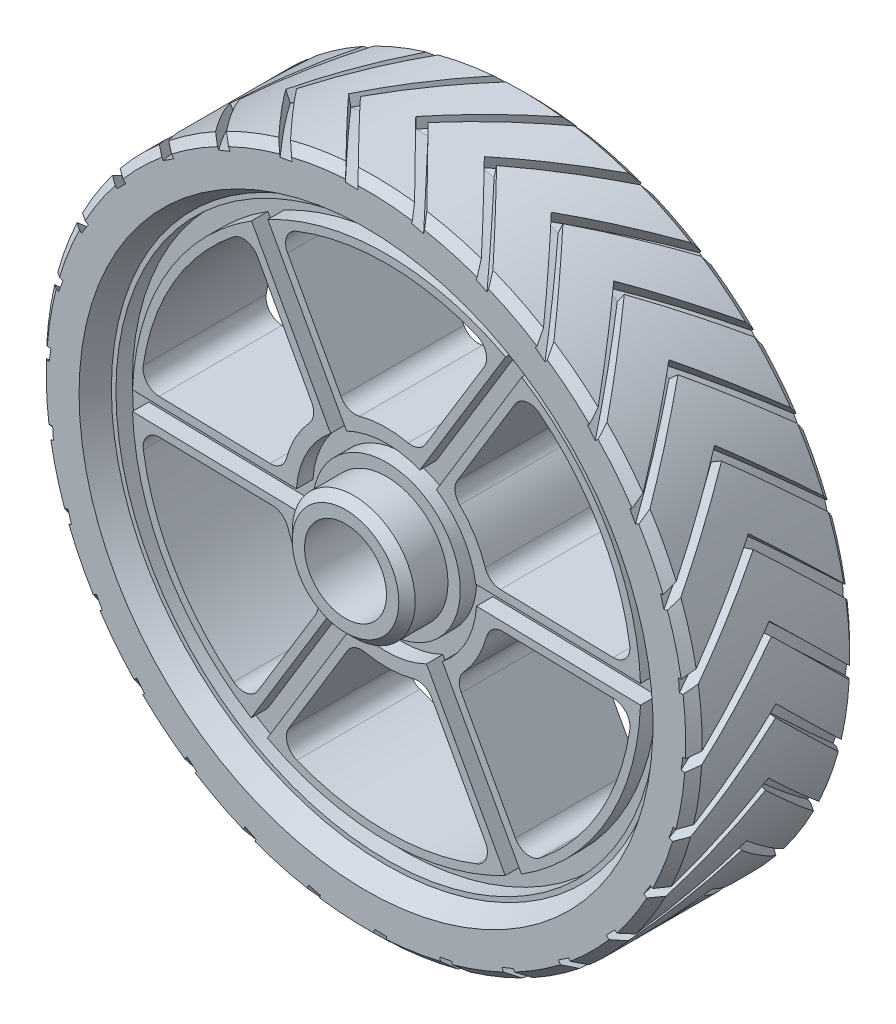
from build123d import *

# Parameters (mm, degrees)
SKETCH1_R               = 40
BOSS_EXTRUDE1_DEPTH     = 10
SKETCH2_R               = 35
CUT_EXTRUDE1_DEPTH      = 2.5
CUT_EXTRUDE1_DRAFT      = -30
MIRROR1_COPY_1_SKETCH_R = 35
MIRROR1_COPY_1_DEPTH    = 2.5
MIRROR1_COPY_1_DRAFT    = -30
CUT_EXTRUDE2_REACH      = 61.214
CIRPATTERN1_COUNT       = 6
SKETCH4_R               = 7.5
SKETCH4_R_2             = 5
BOSS_EXTRUDE2_DEPTH     = 5
CUT_EXTRUDE3_REACH      = 62
SKETCH5_R               = 5
SKETCH6_R               = 33
SKETCH6_R_2             = 9
CUT_EXTRUDE4_DEPTH      = 2
CHAMFER1_SIZE           = 1
CHAMFER2_SIZE           = 1
CUT_SWEEP1_PITCH        = 255
CUT_SWEEP1_HEIGHT       = 13
CUT_SWEEP1_RADIUS       = 40
CUT_SWEEP1_START_ANGLE  = 123
SKETCH8_W               = 1.5
SKETCH8_H               = 2.8
CUT_SWEEP2_PITCH        = 255
CUT_SWEEP2_HEIGHT       = 13
CUT_SWEEP2_RADIUS       = 40
CUT_SWEEP2_START_ANGLE  = 57
SKETCH8_2_W             = 1.5
SKETCH8_2_H             = 2.8
CIRPATTERN2_COUNT       = 30


with BuildPart() as part:
    # Sketch1 → Boss-Extrude1 (new, symmetric)
    with BuildSketch(Plane.XY):
        Circle(SKETCH1_R)
    extrude(amount=BOSS_EXTRUDE1_DEPTH, both=True)


with BuildPart() as cut_extrude1_tool:
    # Sketch2 → Cut-Extrude1 (with draft: the straight prism first)
    with BuildSketch(Plane(origin=(0, 0, -10), x_dir=(-1, 0, 0), z_dir=(0, 0, -1))):
        Circle(SKETCH2_R)
    extrude(amount=-CUT_EXTRUDE1_DEPTH)
    # Cut-Extrude1: the draft: its side faces are tilted about the plane it starts from
    cut_extrude1_sides = [cut_extrude1_tool.faces().sort_by_distance(p)[0] for p in [
        (35, 0, -8.75),
    ]]
    draft(cut_extrude1_sides, Plane(origin=(0, 0, -10), x_dir=(-1, 0, 0), z_dir=(0, 0, -1)), CUT_EXTRUDE1_DRAFT)


with BuildPart() as part_1:
    add(part.part)

    # Cut-Extrude1: cut by cut_extrude1_tool
    add(cut_extrude1_tool.part, mode=Mode.SUBTRACT)


with BuildPart() as mirror1_copy_1_tool:
    # Mirror1 copy 1 sketch → Mirror1 copy 1 (with draft: the straight prism first)
    with BuildSketch(Plane(origin=(0, 0, 10), x_dir=(-1, 0, 0), z_dir=(0, 0, 1))):
        Circle(MIRROR1_COPY_1_SKETCH_R)
    extrude(amount=-MIRROR1_COPY_1_DEPTH)
    # Mirror1 copy 1: the draft: its side faces are tilted about the plane it starts from
    mirror1_copy_1_sides = [mirror1_copy_1_tool.faces().sort_by_distance(p)[0] for p in [
        (35, 0, 8.75),
    ]]
    draft(mirror1_copy_1_sides, Plane(origin=(0, 0, 10), x_dir=(-1, 0, 0), z_dir=(0, 0, 1)), MIRROR1_COPY_1_DRAFT)


with BuildPart() as part_2:
    add(part_1.part)

    # Mirror1 copy 1: cut by mirror1_copy_1_tool
    add(mirror1_copy_1_tool.part, mode=Mode.SUBTRACT)

    # Sketch3 → Cut-Extrude2 (cut, up to next)
    with BuildSketch(Plane(origin=(0, 0, -7.5), x_dir=(-1, 0, 0), z_dir=(0, 0, -1)), mode=Mode.PRIVATE) as cut_extrude2_sk1:
        with BuildLine():
            Line((-4.767989648, 13.290749818), (-11.916023656, 25.033096023))
            ThreePointArc((-11.916023656, 25.033096023), (-12.102700892, 26.712435582), (-10.936778654, 27.935405361))
            ThreePointArc((-10.936778654, 27.935405361), (0.056157906, 29.999947438), (11.041288081, 27.894263882))
            ThreePointArc((11.041288081, 27.894263882), (12.186160929, 26.71434791), (12.060006234, 25.075134521))
            Line((12.060006234, 25.075134521), (5.561856046, 13.190986266))
            ThreePointArc((5.561856046, 13.190986266), (4.592885778, 12.311350051), (3.28744836, 12.219174127))
            ThreePointArc((3.28744836, 12.219174127), (0.331953442, 12.64932172), (-2.642034479, 12.374780276))
            ThreePointArc((-2.642034479, 12.374780276), (-3.851000273, 12.493928026), (-4.767989648, 13.290749818))
        make_face()
    cut_extrude2_tool1 = extrude(cut_extrude2_sk1.sketch, amount=-CUT_EXTRUDE2_REACH, mode=Mode.PRIVATE) & part_2.part
    cut_extrude2 = cut_extrude2_tool1.solids().sort_by_distance((-0.168446, 22.083331, -7.5))[0]
    add(cut_extrude2, mode=Mode.SUBTRACT)

    # CirPattern1: Cut-Extrude2 ×6 about axis
    cirpattern1_axis = Axis((0, 0, 0), (0, 0, 1))
    for i in range(1, CIRPATTERN1_COUNT):
        add(cut_extrude2.rotate(cirpattern1_axis, i * 360 / CIRPATTERN1_COUNT), mode=Mode.SUBTRACT)

    # Sketch4 → Boss-Extrude2 (add)
    with BuildSketch(Plane(origin=(0, 0, -7.5), x_dir=(-1, 0, 0), z_dir=(0, 0, -1))):
        Circle(SKETCH4_R)
        Circle(SKETCH4_R_2, mode=Mode.SUBTRACT)
    boss_extrude2 = extrude(amount=BOSS_EXTRUDE2_DEPTH)

    # Mirror2: Boss-Extrude2 across plane
    add(boss_extrude2.mirror(Plane.XY))

    # Sketch5 → Cut-Extrude3 (cut, up to next)
    with BuildSketch(Plane(origin=(0, 0, -7.5), x_dir=(-1, 0, 0), z_dir=(0, 0, -1)), mode=Mode.PRIVATE) as cut_extrude3_sk1:
        Circle(SKETCH5_R)
    cut_extrude3_tool1 = extrude(cut_extrude3_sk1.sketch, amount=-CUT_EXTRUDE3_REACH, mode=Mode.PRIVATE) & part_2.part
    add(cut_extrude3_tool1.solids().sort_by_distance((0, 0, -7.5))[0], mode=Mode.SUBTRACT)

    # Sketch6 → Cut-Extrude4 (cut)
    with BuildSketch(Plane(origin=(0, 0, -7.5), x_dir=(-1, 0, 0), z_dir=(0, 0, -1))):
        Circle(SKETCH6_R)
        Circle(SKETCH6_R_2, mode=Mode.SUBTRACT)
        with BuildLine():
            Line((-4.069208595, 10.219664447), (-14.520758821, 27.388821867))
            ThreePointArc((-14.520758821, 27.388821867), (-0.024534371, 30.999990291), (14.477387901, 27.411771916))
            Line((14.477387901, 27.411771916), (4.87943883, 9.858553479))
            ThreePointArc((4.87943883, 9.858553479), (0.44352964, 10.991054611), (-4.069208595, 10.219664447))
        make_face(mode=Mode.SUBTRACT)
        with BuildLine():
            Line((-16.500596892, 26.24367166), (-6.098038342, 9.154994723))
            ThreePointArc((-6.098038342, 9.154994723), (-9.296767688, 5.879635241), (-10.885093327, 1.585794207))
            Line((-10.885093327, 1.585794207), (-30.979794927, 1.119064912))
            ThreePointArc((-30.979794927, 1.119064912), (-26.859046295, 15.478747757), (-16.500596892, 26.24367166))
        make_face(mode=Mode.SUBTRACT)
        with BuildLine():
            Line((16.459036106, 26.269756955), (6.815884732, 8.63387024))
            ThreePointArc((6.815884732, 8.63387024), (9.740297327, 5.11141937), (10.977477173, 0.703558756))
            Line((10.977477173, 0.703558756), (30.977984792, 1.168100256))
            ThreePointArc((30.977984792, 1.168100256), (26.834511924, 15.521242535), (16.459036106, 26.269756955))
        make_face(mode=Mode.SUBTRACT)
        with BuildLine():
            Line((-10.977477173, -0.703558756), (-30.977984792, -1.168100256))
            ThreePointArc((-30.977984792, -1.168100256), (-26.834511924, -15.521242535), (-16.459036106, -26.269756955))
            Line((-16.459036106, -26.269756955), (-6.815884732, -8.63387024))
            ThreePointArc((-6.815884732, -8.63387024), (-9.740297327, -5.11141937), (-10.977477173, -0.703558756))
        make_face(mode=Mode.SUBTRACT)
        with BuildLine():
            Line((10.885093327, -1.585794207), (30.979794927, -1.119064912))
            ThreePointArc((30.979794927, -1.119064912), (26.859046295, -15.478747757), (16.500596892, -26.24367166))
            Line((16.500596892, -26.24367166), (6.098038342, -9.154994723))
            ThreePointArc((6.098038342, -9.154994723), (9.296767688, -5.879635241), (10.885093327, -1.585794207))
        make_face(mode=Mode.SUBTRACT)
        with BuildLine():
            Line((14.520758821, -27.388821867), (4.069208595, -10.219664447))
            ThreePointArc((4.069208595, -10.219664447), (-0.44352964, -10.991054611), (-4.87943883, -9.858553479))
            Line((-4.87943883, -9.858553479), (-14.477387901, -27.411771916))
            ThreePointArc((-14.477387901, -27.411771916), (0.024534371, -30.999990291), (14.520758821, -27.388821867))
        make_face(mode=Mode.SUBTRACT)
    cut_extrude4 = extrude(amount=-CUT_EXTRUDE4_DEPTH, mode=Mode.SUBTRACT)

    # Mirror3: Cut-Extrude4 across plane
    add(cut_extrude4.mirror(Plane.XY), mode=Mode.SUBTRACT)

    # Chamfer1
    chamfer1_edges = [part_2.edges().sort_by_distance(p)[0] for p in [
        (7.5, 0, -12.5),
        (7.5, 0, 12.5),
    ]]
    chamfer(chamfer1_edges, length=CHAMFER1_SIZE)

    # Chamfer2
    chamfer2_edges = [part_2.edges().sort_by_distance(p)[0] for p in [
        (-40, 0, -10),
        (-40, 0, 10),
    ]]
    chamfer(chamfer2_edges, length=CHAMFER2_SIZE)

    # Cut-Sweep1: sweep along a helix
    with BuildLine() as cut_sweep1_path:
        add(Helix(CUT_SWEEP1_PITCH, CUT_SWEEP1_HEIGHT, CUT_SWEEP1_RADIUS, center=(0, 0, 0), direction=(0, 0, 1), lefthand=True, mode=Mode.PRIVATE).rotate(Axis((0, 0, 0), (0, 0, 1)), CUT_SWEEP1_START_ANGLE))
    # Sketch8 → Cut-Sweep1 (sweep, cut)
    with BuildSketch(Plane.XY):
        with Locations((-3.181042924, 39.873311449)):
            Rectangle(SKETCH8_W, SKETCH8_H)
    cut_sweep1 = sweep(path=cut_sweep1_path.line, is_frenet=True, mode=Mode.SUBTRACT)

    # Cut-Sweep2: sweep along a helix
    with BuildLine() as cut_sweep2_path:
        add(Helix(CUT_SWEEP2_PITCH, CUT_SWEEP2_HEIGHT, CUT_SWEEP2_RADIUS, center=(0, 0, 0), direction=(0, 0, -1), mode=Mode.PRIVATE).rotate(Axis((0, 0, 0), (0, 0, -1)), CUT_SWEEP2_START_ANGLE))
    # Sketch8<2> → Cut-Sweep2 (sweep, cut)
    with BuildSketch(Plane.XY):
        with Locations((-3.181042924, 39.873311449)):
            Rectangle(SKETCH8_2_W, SKETCH8_2_H)
    cut_sweep2 = sweep(path=cut_sweep2_path.line, is_frenet=True, mode=Mode.SUBTRACT)

    # CirPattern2: Cut-Sweep1, Cut-Sweep2 ×30 about axis
    cirpattern2_axis = Axis((0, 0, 9), (0, 0, 1))
    add([cut_sweep1.rotate(cirpattern2_axis, i * 360 / CIRPATTERN2_COUNT) for i in range(1, CIRPATTERN2_COUNT)], mode=Mode.SUBTRACT)
    add([cut_sweep2.rotate(cirpattern2_axis, i * 360 / CIRPATTERN2_COUNT) for i in range(1, CIRPATTERN2_COUNT)], mode=Mode.SUBTRACT)


solid = part_2.part
